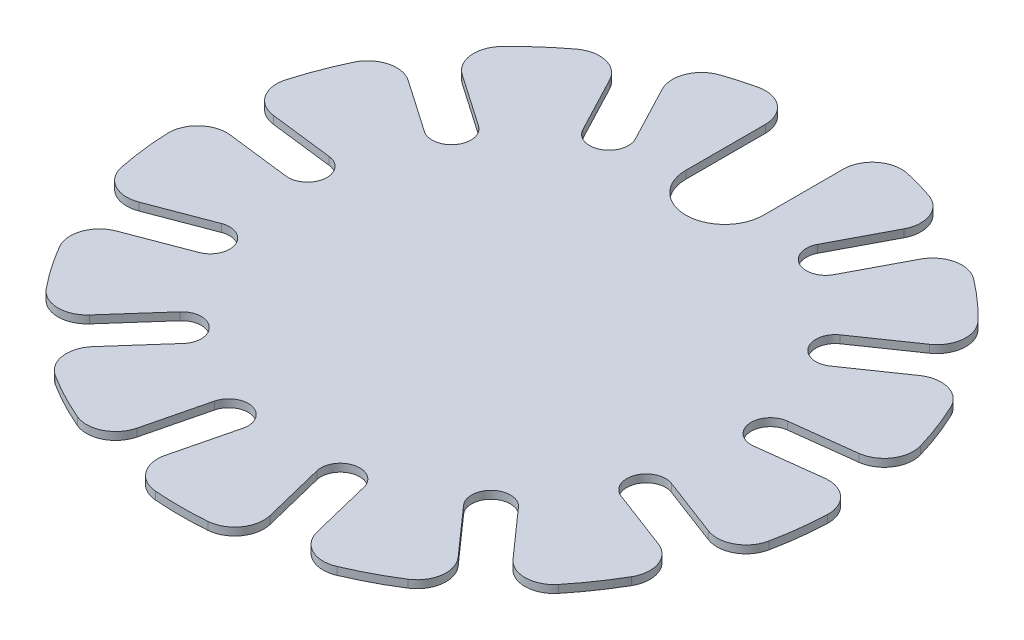
from build123d import *

# Parameters (mm, degrees)
BOSS_EXTRUDE1_DEPTH     = 0.1
CUT_EXTRUDE1_DEPTH      = 13.021231218
CUT_EXTRUDE1_DEPTH_BACK = 13.021231218
FILLET1_R               = 0.75


with BuildPart() as part:
    # Sketch1 → Boss-Extrude1 (new, symmetric)
    with BuildSketch(Plane(origin=(0, 0, 0), x_dir=(1, 0, 0), z_dir=(0, 1, 0))):
        with BuildLine():
            Line((-0.5, 6), (-0.5, 8.485281374))
            ThreePointArc((-0.5, 8.485281374), (-2.034183146, 8.253005448), (-3.500578863, 7.745705108))
            Line((-3.500578863, 7.745705108), (-2.345611019, 5.54509774))
            ThreePointArc((-2.345611019, 5.54509774), (-2.555977446, 4.870008141), (-3.231067045, 5.080374568))
            Line((-3.231067045, 5.080374568), (-4.386034889, 7.280981936))
            ThreePointArc((-4.386034889, 7.280981936), (-5.636542595, 6.362341359), (-6.699217295, 5.231681148))
            Line((-6.699217295, 5.231681148), (-4.653870822, 3.819880413))
            ThreePointArc((-4.653870822, 3.819880413), (-4.526411262, 3.124356107), (-5.221935569, 2.996896547))
            Line((-5.221935569, 2.996896547), (-7.267282042, 4.408697282))
            ThreePointArc((-7.267282042, 4.408697282), (-7.947638063, 3.01414154), (-8.363145779, 1.519142085))
            Line((-8.363145779, 1.519142085), (-5.895984904, 1.219574519))
            ThreePointArc((-5.895984904, 1.219574519), (-5.459898808, 0.662951741), (-6.016521585, 0.226865644))
            Line((-6.016521585, 0.226865644), (-8.48368246, 0.526433211))
            ThreePointArc((-8.48368246, 0.526433211), (-8.43802543, -1.024561782), (-8.111178352, -2.541414122))
            Line((-8.111178352, -2.541414122), (-5.7873999, -1.660121201))
            ThreePointArc((-5.7873999, -1.660121201), (-5.142589335, -1.950326879), (-5.432795013, -2.595137444))
            Line((-5.432795013, -2.595137444), (-7.756573465, -3.476430365))
            ThreePointArc((-7.756573465, -3.476430365), (-6.99536286, -4.828550347), (-6.001037715, -6.019762981))
            Line((-6.001037715, -6.019762981), (-4.352991324, -4.15950316))
            ThreePointArc((-4.352991324, -4.15950316), (-3.64717462, -4.116809115), (-3.604480575, -4.822625818))
            Line((-3.604480575, -4.822625818), (-5.252526967, -6.682885639))
            ThreePointArc((-5.252526967, -6.682885639), (-3.950146962, -7.526376218), (-2.516131657, -8.119056687))
            Line((-2.516131657, -8.119056687), (-1.921364894, -5.705993072))
            ThreePointArc((-1.921364894, -5.705993072), (-1.316236154, -5.340179996), (-0.950423077, -5.945308737))
            Line((-0.950423077, -5.945308737), (-1.54518984, -8.358372351))
            ThreePointArc((-1.54518984, -8.358372351), (0, -8.5), (1.54518984, -8.358372351))
            Line((1.54518984, -8.358372351), (0.950423077, -5.945308737))
            ThreePointArc((0.950423077, -5.945308737), (1.316236154, -5.340179996), (1.921364894, -5.705993072))
            Line((1.921364894, -5.705993072), (2.516131657, -8.119056687))
            ThreePointArc((2.516131657, -8.119056687), (3.950146962, -7.526376218), (5.252526967, -6.682885639))
            Line((5.252526967, -6.682885639), (3.604480575, -4.822625818))
            ThreePointArc((3.604480575, -4.822625818), (3.64717462, -4.116809115), (4.352991324, -4.15950316))
            Line((4.352991324, -4.15950316), (6.001037715, -6.019762981))
            ThreePointArc((6.001037715, -6.019762981), (6.99536286, -4.828550347), (7.756573465, -3.476430365))
            Line((7.756573465, -3.476430365), (5.432795013, -2.595137444))
            ThreePointArc((5.432795013, -2.595137444), (5.142589335, -1.950326879), (5.7873999, -1.660121201))
            Line((5.7873999, -1.660121201), (8.111178352, -2.541414122))
            ThreePointArc((8.111178352, -2.541414122), (8.43802543, -1.024561782), (8.48368246, 0.526433211))
            Line((8.48368246, 0.526433211), (6.016521585, 0.226865644))
            ThreePointArc((6.016521585, 0.226865644), (5.459898808, 0.662951741), (5.895984904, 1.219574519))
            Line((5.895984904, 1.219574519), (8.363145779, 1.519142085))
            ThreePointArc((8.363145779, 1.519142085), (7.947638063, 3.01414154), (7.267282042, 4.408697282))
            Line((7.267282042, 4.408697282), (5.221935569, 2.996896547))
            ThreePointArc((5.221935569, 2.996896547), (4.526411262, 3.124356107), (4.653870822, 3.819880413))
            Line((4.653870822, 3.819880413), (6.699217295, 5.231681148))
            ThreePointArc((6.699217295, 5.231681148), (5.636542595, 6.362341359), (4.386034889, 7.280981936))
            Line((4.386034889, 7.280981936), (3.231067045, 5.080374568))
            ThreePointArc((3.231067045, 5.080374568), (2.555977446, 4.870008141), (2.345611019, 5.54509774))
            Line((2.345611019, 5.54509774), (3.500578863, 7.745705108))
            ThreePointArc((3.500578863, 7.745705108), (2.034183146, 8.253005448), (0.5, 8.485281374))
            Line((0.5, 8.485281374), (0.5, 6))
            ThreePointArc((0.5, 6), (0, 5.5), (-0.5, 6))
        make_face()
    extrude(amount=BOSS_EXTRUDE1_DEPTH, both=True)

    # Sketch2 → Cut-Extrude1 (cut, two sides: drawn at the far end of the back side and taken through both)
    with BuildSketch(Plane(origin=(0, 0, 0), x_dir=(1, 0, 0), z_dir=(0, 1, 0)).offset(-CUT_EXTRUDE1_DEPTH_BACK)):
        with BuildLine():
            Line((-1, 5.5), (-1, 8.485281374))
            Line((-1, 8.485281374), (1, 8.485281374))
            Line((1, 8.485281374), (1, 5.5))
            ThreePointArc((1, 5.5), (0, 4.5), (-1, 5.5))
        make_face()
    extrude(amount=CUT_EXTRUDE1_DEPTH + CUT_EXTRUDE1_DEPTH_BACK, mode=Mode.SUBTRACT)

    # Fillet1
    fillet1_edges = [part.edges().sort_by_distance(p)[0] for p in [
        (4.386034889, 0, -7.280981936),
        (6.699217295, 0, -5.231681148),
        (7.267282042, 0, -4.408697282),
        (8.363145779, 0, -1.519142085),
        (8.48368246, 0, -0.526433211),
        (8.111178352, 0, 2.541414122),
        (7.756573465, 0, 3.476430365),
        (6.001037715, 0, 6.019762981),
        (5.252526967, 0, 6.682885639),
        (2.516131657, 0, 8.119056687),
        (1.54518984, 0, 8.358372351),
        (-1.54518984, 0, 8.358372351),
        (-2.516131657, 0, 8.119056687),
        (-5.252526967, 0, 6.682885639),
        (-6.001037715, 0, 6.019762981),
        (-7.756573465, 0, 3.476430365),
        (-8.111178352, 0, 2.541414122),
        (-8.48368246, 0, -0.526433211),
        (-8.363145779, 0, -1.519142085),
        (-7.267282042, 0, -4.408697282),
        (-6.699217295, 0, -5.231681148),
        (-4.386034889, 0, -7.280981936),
        (-3.500578863, 0, -7.745705108),
        (3.500578863, 0, -7.745705108),
        (1, 0, -8.440971508),
        (-1, 0, -8.440971508),
    ]]
    fillet(fillet1_edges, radius=FILLET1_R)


solid = part.part
